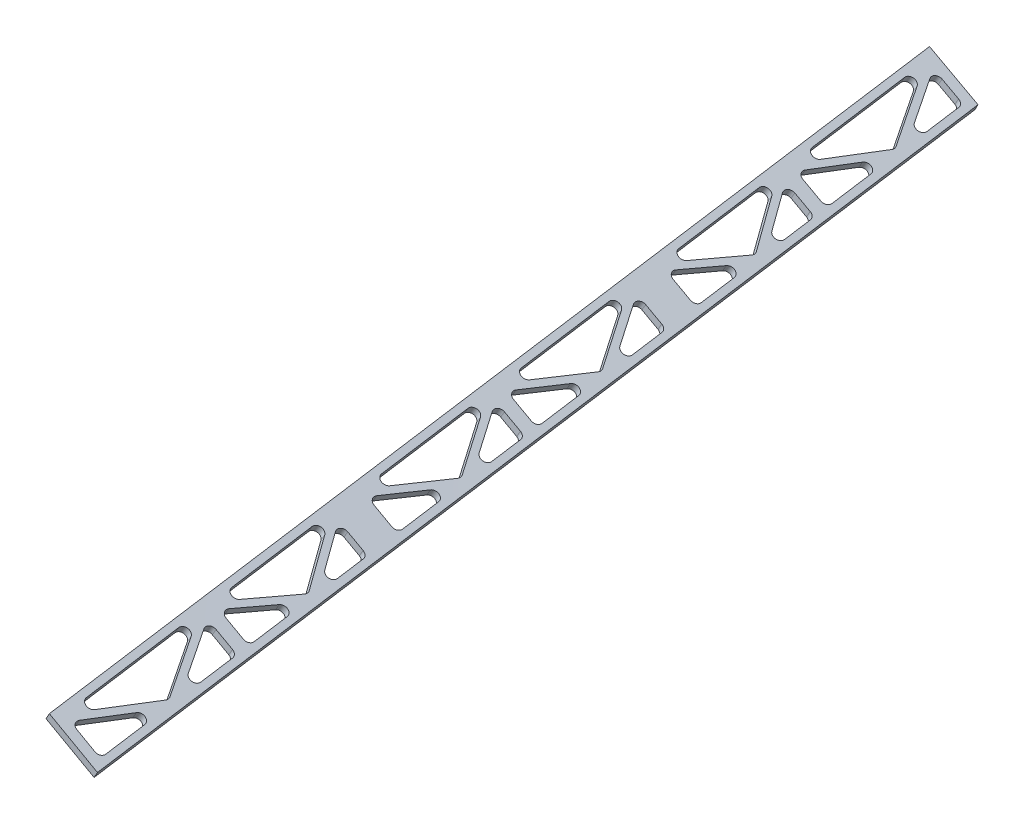
from build123d import *

# Parameters (mm, degrees)
CUT_EXTRUDE3_DEPTH      = 619.917239884
CUT_EXTRUDE3_DEPTH_BACK = 619.917239884
FILLET1_R               = 2.54


with BuildPart() as part:
    # Loft5: read off the stored shape, not the designer's step
    # Loft5: loft between two sections, ruled curve by curve
    loft5_from = [
        Edge.make_bspline([(417.844624782, 0.531125937, -469.138), (418.095787401, 0.99688843, -469.138), (418.34695002, 1.462650923, -469.138), (418.849275257, 2.394175909, -469.138), (419.100437876, 2.859938403, -469.138), (419.351600495, 3.325700896, -469.138)], [0, 0, 0, 0, 0.5, 0.5, 1, 1, 1, 1], 3),
        Edge.make_bspline([(419.351600495, 3.325700896, -469.138), (415.625500549, 5.335001846, -469.138), (411.899400604, 7.344302796, -469.138), (404.447200713, 11.362904696, -469.138), (400.721100768, 13.372205646, -469.138), (396.995000822, 15.381506596, -469.138)], [0, 0, 0, 0, 0.5, 0.5, 1, 1, 1, 1], 3),
        Edge.make_bspline([(395.48802511, 12.586931637, -469.138), (399.214125055, 10.577630687, -469.138), (402.940225001, 8.568329737, -469.138), (410.392424891, 4.549727837, -469.138), (414.118524837, 2.540426887, -469.138), (417.844624782, 0.531125937, -469.138)], [0, 0, 0, 0, 0.5, 0.5, 1, 1, 1, 1], 3),
        Edge.make_bspline([(396.995000822, 15.381506596, -469.138), (396.743838204, 14.915744103, -469.138), (396.492675585, 14.44998161, -469.138), (395.990350347, 13.518456623, -469.138), (395.739187729, 13.05269413, -469.138), (395.48802511, 12.586931637, -469.138)], [0, 0, 0, 0, 0.5, 0.5, 1, 1, 1, 1], 3),
    ]
    loft5_to = [
        Edge.make_bspline([(481.037573789, 0.181369953, 0), (481.295707245, 0.643305533, 0), (481.5538407, 1.105241114, 0), (482.070107611, 2.029112274, 0), (482.328241067, 2.491047854, 0), (482.586374523, 2.952983434, 0)], [0, 0, 0, 0, 0.5, 0.5, 1, 1, 1, 1], 3),
        Edge.make_bspline([(482.586374523, 2.952983434, 0), (478.89088988, 5.01805108, 0), (475.195405237, 7.083118725, 0), (467.804435952, 11.213254016, 0), (464.10895131, 13.278321661, 0), (460.413466667, 15.343389307, 0)], [0, 0, 0, 0, 0.5, 0.5, 1, 1, 1, 1], 3),
        Edge.make_bspline([(458.864665934, 12.571775826, 0), (462.560150576, 10.50670818, 0), (466.255635219, 8.441640535, 0), (473.646604504, 4.311505244, 0), (477.342089146, 2.246437599, 0), (481.037573789, 0.181369953, 0)], [0, 0, 0, 0, 0.5, 0.5, 1, 1, 1, 1], 3),
        Edge.make_bspline([(460.413466667, 15.343389307, 0), (460.155333212, 14.881453727, 0), (459.897199756, 14.419518146, 0), (459.380932845, 13.495646986, 0), (459.122799389, 13.033711406, 0), (458.864665934, 12.571775826, 0)], [0, 0, 0, 0, 0.5, 0.5, 1, 1, 1, 1], 3),
    ]
    loft5 = Solid(Shell([*[Face.make_surface_from_curves(loft5_from[k], loft5_to[k]) for k in range(4)], Face(Wire(loft5_from)), Face(Wire(loft5_to))]))
    add(loft5)

    # Sketch4 → Cut-Extrude3 (cut, two sides: drawn at the far end of the back side and taken through both)
    with BuildSketch(Plane(origin=(115.839356083, 207.297113174, -15.642417888), x_dir=(0.873537777740391, -0.4853764395115546, 0.03662598568592413), z_dir=(0.4867563567744949, 0.8710613645563452, -0.06572935658333033)).offset(-CUT_EXTRUDE3_DEPTH_BACK)):
        Polygon((416.193853557, 4.399155053), (410.793417241, 39.194793304), (400.316010959, 3.815960104), align=None)
        Polygon((408.488685502, 42.593666479), (386.023000675, 75.726067245), (397.121606676, 4.210695069), align=None)
        Polygon((404.936309125, 76.932820992), (389.427066694, 76.363164768), (409.654747793, 46.531372776), align=None)
        Polygon((403.955686788, 83.251084575), (399.235521822, 113.663655529), (388.295732199, 82.675892677), align=None)
        Polygon((396.940305569, 116.699699939), (375.201419831, 145.456390275), (384.93963149, 82.706903439), align=None)
        Polygon((394.169075862, 146.307355139), (378.960543443, 145.748744028), (398.207282328, 120.288721983), align=None)
        Polygon((391.717520018, 162.103014098), (386.657101167, 194.707880344), (375.94285807, 161.523608985), align=None)
        Polygon((384.359340095, 197.924728267), (362.256286867, 228.870109235), (372.67498502, 161.735815437), align=None)
        Polygon((381.195442339, 229.897982349), (365.827028016, 229.333498758), (385.573936042, 201.686839018), align=None)
        Polygon((380.214820002, 236.216245932), (375.083401631, 269.278570324), (364.418737016, 235.636054023), align=None)
        Polygon((372.784510401, 272.533516167), (350.606688191, 303.935877408), (361.167406669, 235.886456388), align=None)
        Polygon((369.542065499, 304.982042453), (354.14351615, 304.431683465), (373.988634921, 276.332279359), align=None)
        Polygon((367.090223135, 320.779547502), (362.366748907, 351.213440414), (351.428843342, 320.219794701), align=None)
        Polygon((360.071532786, 354.250201943), (338.334920011, 383.010679108), (348.074172486, 320.254485632), align=None)
        Polygon((357.302468415, 383.843187658), (342.096270238, 383.299703487), (361.338292043, 357.839907407), align=None)
        Polygon((356.321731469, 390.162189678), (350.917996467, 424.979081751), (340.444450776, 389.594720371), align=None)
        Polygon((348.61321002, 428.379081093), (326.151578057, 461.515694436), (337.251270191, 389.993323609), align=None)
        Polygon((345.062871331, 462.704332863), (329.55719952, 462.150145216), (349.778983075, 432.317877291), align=None)
    extrude(amount=CUT_EXTRUDE3_DEPTH + CUT_EXTRUDE3_DEPTH_BACK, mode=Mode.SUBTRACT)

    # Fillet1
    fillet1_edges = [part.edges().sort_by_distance(p)[0] for p in [
        (452.648117325, 3.270550035, -195.508223856),
        (443.237547792, 10.876187003, -162.803523368),
        (457.057298595, 3.24749922, -162.808923119),
        (440.374800082, 12.431806504, -163.133718499),
        (450.636536733, 4.135904388, -198.799515936),
        (431.277001635, 12.443232185, -230.459736164),
        (463.607787283, 3.213248057, -114.229267692),
        (454.020522501, 10.799461396, -83.725854663),
        (467.720498777, 3.191740001, -83.728611322),
        (451.084505568, 12.418340515, -83.87911247),
        (461.600589859, 4.094837455, -117.340467317),
        (442.58092828, 12.429034011, -146.807801988),
        (471.66500253, 4.023521285, -43.018370176),
        (452.030522173, 12.417150199, -76.878340053),
        (461.722011492, 12.404948226, -5.158730098),
        (421.508315058, 3.433257051, -426.446360212),
        (412.250455097, 10.984626266, -391.531219896),
        (426.216643386, 3.408665824, -391.528628657),
        (418.89290789, 12.458765021, -322.105088935),
        (429.469798713, 4.250645484, -355.578078612),
        (410.38839874, 12.469418494, -385.040501141),
        (442.563858709, 3.323257888, -270.294894363),
        (433.178106591, 10.906220748, -237.128935186),
        (447.034906431, 3.29989088, -237.136811076),
        (437.735644199, 3.348487938, -306.101774711),
        (424.211047818, 10.732674387, -306.107053854),
        (441.60997909, 3.328242726, -277.369033128),
        (431.483725152, 3.38115204, -352.467072577),
        (421.840027024, 10.862959636, -321.949881616),
        (435.599331891, 3.359650135, -321.945034095),
        (416.406683748, 3.459898436, -464.280873925),
        (402.749807773, 10.827105884, -464.281032306),
        (420.515881049, 3.438439999, -433.806410926),
        (464.512644367, 10.884519488, -4.648142986),
        (473.678256635, 3.16057816, -39.544717298),
        (421.104350024, 12.455992997, -305.739878002),
        (430.32617106, 12.444425588, -237.49612073),
        (440.549240086, 4.182624174, -273.623940822),
        (430.587620982, 3.385833357, -359.112731754),
        (427.071169078, 3.404202321, -385.191325007),
        (413.696788133, 10.66263632, -385.194009366),
        (399.749653442, 12.482730168, -463.769709425),
        (409.442133768, 12.470603193, -392.043086583),
        (419.48436488, 4.27708665, -429.919700173),
        (472.686126953, 3.165767856, -46.902546154),
        (468.574921427, 3.187271325, -77.392047818),
        (455.00832452, 10.724513855, -77.389524311),
        (451.704347121, 3.275483576, -202.507395874),
        (447.889330667, 3.295425042, -230.800247785),
        (434.409211086, 10.698532158, -230.792789901),
        (462.711875093, 3.217933006, -120.873522623),
        (459.193357141, 3.236330967, -146.967514616),
        (445.873328384, 10.597949554, -146.962815229),
        (478.383688757, 3.135962526, -4.648298148),
    ]]
    fillet(fillet1_edges, radius=FILLET1_R)


solid = part.part
